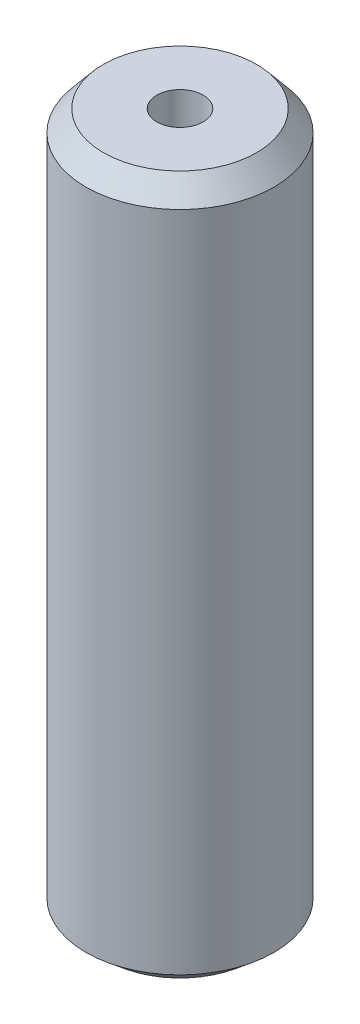
from build123d import *
from OCP.BRepFilletAPI import BRepFilletAPI_MakeChamfer

# Parameters (mm, degrees)
SKETCH1_R           = 10
BOSS_EXTRUDE1_DEPTH = 74.518870163
SKETCH2_R           = 2.466208443
CUT_EXTRUDE1_DEPTH  = 76.848942052
CHAMFER1_SIZE       = 2.229674436
CHAMFER1_SIZE2      = 1.86421463


with BuildPart() as part:
    # Sketch1 → Boss-Extrude1 (new body)
    with BuildSketch(Plane(origin=(0, 0, 0), x_dir=(1, 0, 0), z_dir=(0, 1, 0))):
        Circle(SKETCH1_R)
    extrude(amount=BOSS_EXTRUDE1_DEPTH)

    # Sketch2 → Cut-Extrude1 (cut, through all)
    with BuildSketch(Plane(origin=(0, 0, 0), x_dir=(1, 0, 0), z_dir=(0, 1, 0))):
        Circle(SKETCH2_R)
    extrude(amount=CUT_EXTRUDE1_DEPTH, mode=Mode.SUBTRACT)

    # Chamfer1: one chamfer whose edges measure the first distance from different faces: ONE call of the kernel's chamfer builder (chamfer() names one face for all edges)
    chamfer1_edges_1 = [part.edges().sort_by_distance(p)[0] for p in [
        (-10, 74.518870163, 0),
    ]]
    chamfer1_side_1 = [part.faces().sort_by_distance(p)[0] for p in [
        (-10, 37.259435081, 0),
    ]]
    chamfer1_edges_2 = [part.edges().sort_by_distance(p)[0] for p in [
        (-10, 0, 0),
    ]]
    chamfer1_side_2 = [part.faces().sort_by_distance(p)[0] for p in [
        (-9.717157288, 0, 0),
    ]]
    chamfer1 = BRepFilletAPI_MakeChamfer(part.part.solid().wrapped)
    for e in chamfer1_edges_1:
        chamfer1.Add(CHAMFER1_SIZE, CHAMFER1_SIZE2, e.wrapped, chamfer1_side_1[0].wrapped)  # the first distance lies on this face
    for e in chamfer1_edges_2:
        chamfer1.Add(CHAMFER1_SIZE, CHAMFER1_SIZE2, e.wrapped, chamfer1_side_2[0].wrapped)  # the first distance lies on this face
    add(Compound.cast(chamfer1.Shape()), mode=Mode.REPLACE)


solid = part.part
